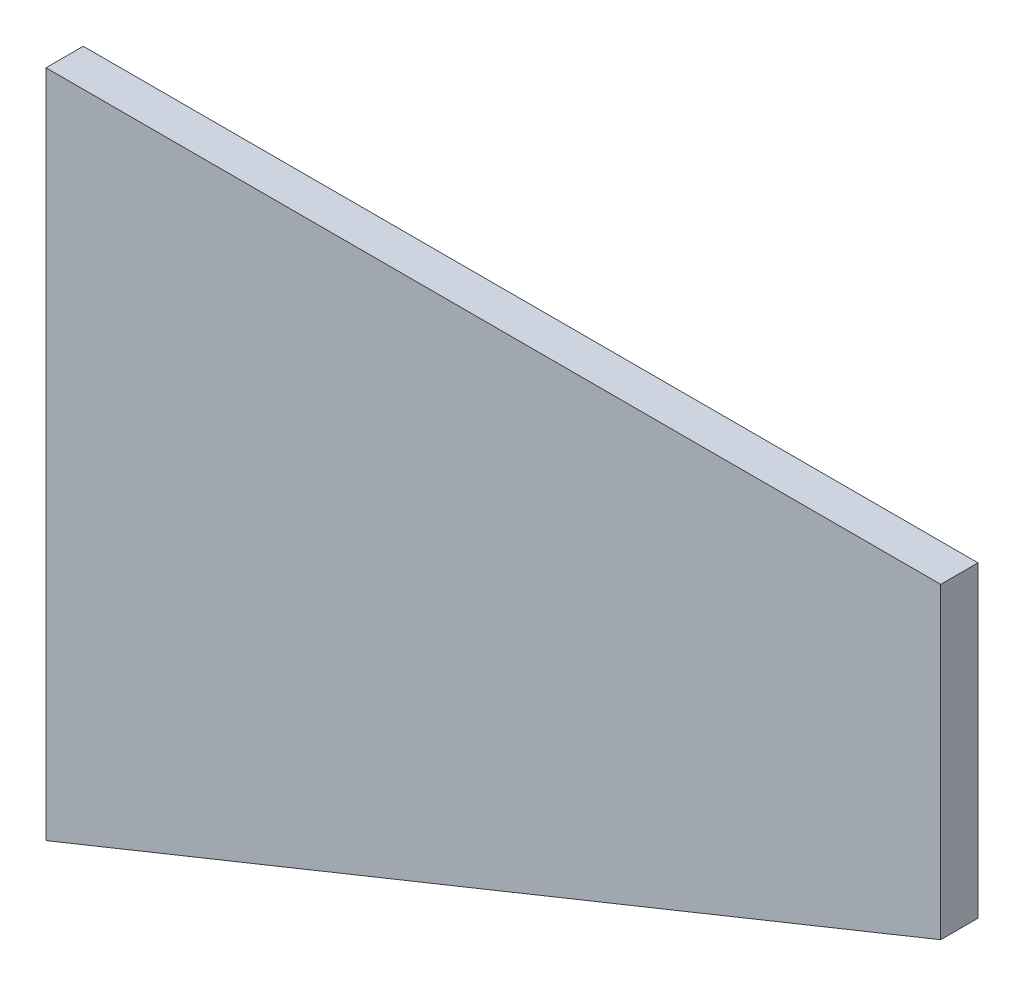
from build123d import *

# Parameters (mm, degrees)
BOSS_EXTRUDE1_DEPTH = 19.05


with BuildPart() as part:
    # Sketch1 → Boss-Extrude1 (new body)
    with BuildSketch(Plane.XY):
        Polygon((2683.51, 6983.72999014), (2683.51, 6641.741886848), (3140.71, 6826.4626773), (3140.71, 6983.72999014), align=None)
    extrude(amount=BOSS_EXTRUDE1_DEPTH)


solid = part.part
